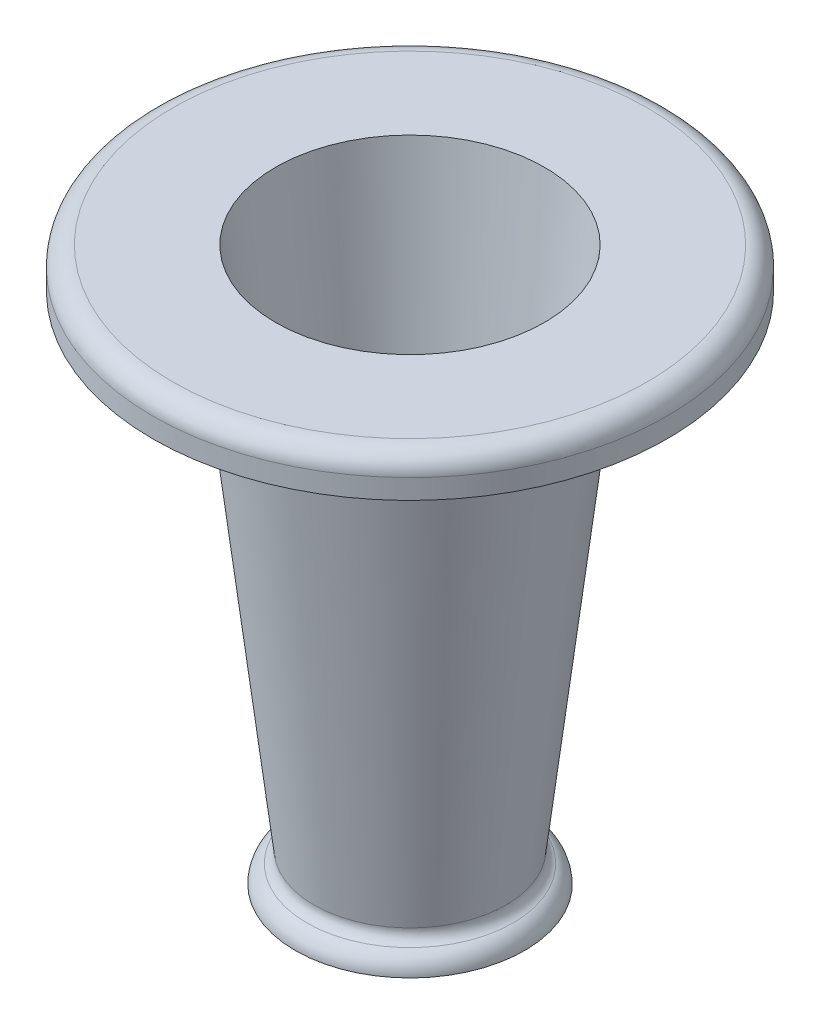
from build123d import *

# Parameters (mm, degrees)
CROQUIS1_R              = 29
SALIENTE_EXTRUIR1_DEPTH = 5
CROQUIS2_R              = 24
CROQUIS3_R              = 39
CROQUIS4_R              = 65
SALIENTE_EXTRUIR2_DEPTH = 5
SALIENTE_EXTRUIR3_START = 5
CROQUIS5_R              = 65
CROQUIS5_R_2            = 62.5
SALIENTE_EXTRUIR3_DEPTH = 5
REDONDEO1_R             = 5
CROQUIS6_R              = 23
CORTAR_EXTRUIR1_DEPTH   = 62
REDONDEO2_R             = 3


with BuildPart() as part:
    # Croquis1 → Saliente-Extruir1 (new body)
    with BuildSketch(Plane(origin=(0, 0, 0), x_dir=(1, 0, 0), z_dir=(0, 1, 0))):
        with Locations(Location((0, 0, 0), (0, 0, 270))):
            Circle(CROQUIS1_R)
    extrude(amount=SALIENTE_EXTRUIR1_DEPTH)

    # Croquis2 → Recubrir1 section 0
    with BuildSketch(Plane(origin=(0, 5, 0), x_dir=(1, 0, 0), z_dir=(0, 1, 0))):
        Circle(CROQUIS2_R)
    # Croquis3 → Recubrir1 section 1
    with BuildSketch(Plane(origin=(0, 135, 0), x_dir=(1, 0, 0), z_dir=(0, 1, 0))):
        Circle(CROQUIS3_R)
    loft()

    # Croquis4 → Saliente-Extruir2 (add)
    with BuildSketch(Plane(origin=(0, 135, 0), x_dir=(1, 0, 0), z_dir=(0, 1, 0))):
        with Locations(Location((0, 0, 0), (0, 0, 270))):
            Circle(CROQUIS4_R)
    extrude(amount=SALIENTE_EXTRUIR2_DEPTH)

    # Croquis5 → Saliente-Extruir3 (add)
    with BuildSketch(Plane.XZ.offset(-135).offset(SALIENTE_EXTRUIR3_START)):
        with Locations(Location((0, 0, 0), (0, 0, 270))):
            Circle(CROQUIS5_R)
        with Locations(Location((0, 0, 0), (0, 0, 270))):
            Circle(CROQUIS5_R_2, mode=Mode.SUBTRACT)
    extrude(amount=-SALIENTE_EXTRUIR3_DEPTH)

    # Redondeo1
    redondeo1_edges = [part.edges().sort_by_distance(p)[0] for p in [
        (0, 140, -65),
        (0, 135, 62.5),
        (0, 5, -29),
    ]]
    fillet(redondeo1_edges, radius=REDONDEO1_R - 0.0001)  # a hair under: the kernel refuses the full size

    # Croquis6 → Cortar-Extruir1 (cut)
    with BuildSketch(Plane.XZ):
        with Locations(Location((0, 0, 0), (0, 0, 270))):
            Circle(CROQUIS6_R)
    extrude(amount=-CORTAR_EXTRUIR1_DEPTH, mode=Mode.SUBTRACT)

    # Croquis7 → Cortar-Revolución1 (revolve, cut)
    with BuildSketch(Plane.XY, mode=Mode.PRIVATE) as cortar_revoluci_n1_sk:
        Polygon((22, 37.952055194), (0, 37.952055194), (0, 140), (34, 140), align=None)
    revolve(cortar_revoluci_n1_sk.sketch.rotate(Axis((0, 192.821641375, 0), (0, -1, 0)), 90), axis=Axis((0, 192.821641375, 0), (0, -1, 0)), mode=Mode.SUBTRACT)

    # Redondeo2
    redondeo2_edges = [part.edges().sort_by_distance(p)[0] for p in [
        (-24, 5, 0),
    ]]
    fillet(redondeo2_edges, radius=REDONDEO2_R)


solid = part.part
